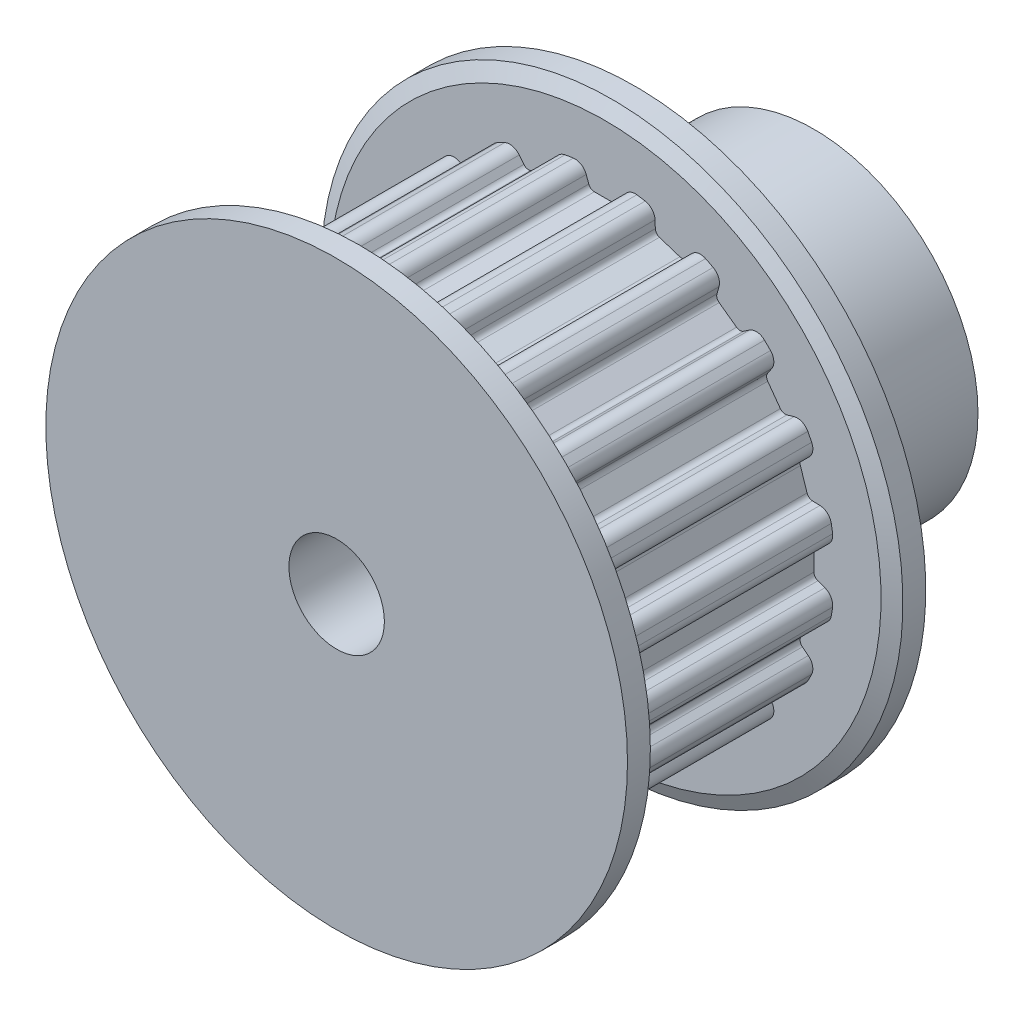
from build123d import *

# Parameters (mm, degrees)
SKETCH5_W           = 10
SKETCH5_H           = 7.7
SKETCH16_W          = 6
SKETCH16_H          = 5.5
SKETCH17_W          = 16
SKETCH17_H          = 2
CUT_TOOTH_REACH     = 21.354
PATTERN_TOOTH_COUNT = 20
SKETCH_2_R          = 2.9
CUT_EXTRUDE_1_DEPTH = 10
SKETCH_3_R          = 2.876983992
SKETCH_3_R_2        = 1.6
EXTRUDE_1_DEPTH     = 7


with BuildPart() as part:
    # Sketch5 → body (revolve)
    with BuildSketch(Plane(origin=(0, 0, 0), x_dir=(0, 0, -1), z_dir=(1, 0, 0))):
        with Locations((5, 3.85)):
            Rectangle(SKETCH5_W, SKETCH5_H)
    revolve(axis=Axis((0, 0, 0), (0, 0, -1)))

    # Sketch16 → body-hub (revolve)
    with BuildSketch(Plane(origin=(0, 0, 0), x_dir=(0, 0, -1), z_dir=(1, 0, 0))):
        with Locations((13, 2.75)):
            Rectangle(SKETCH16_W, SKETCH16_H)
    revolve(axis=Axis((0, 0, -16), (0, 0, 1)))

    # Sketch17 → body-bore (revolve, cut)
    with BuildSketch(Plane(origin=(0, 0, 0), x_dir=(0, 0, -1), z_dir=(1, 0, 0))):
        with Locations((8, 1)):
            Rectangle(SKETCH17_W, SKETCH17_H)
    revolve(axis=Axis((0, 0, -16), (0, 0, 1)), mode=Mode.SUBTRACT)

    # Sketch23 → cut-tooth (cut, up to next)
    with BuildSketch(Plane.XY, mode=Mode.PRIVATE) as cut_tooth_sk1:
        with BuildLine():
            Line((0.547897017, 7.131595971), (0.633465137, 7.366692451))
            ThreePointArc((0.633465137, 7.366692451), (0.803169961, 7.572656933), (1.064648607, 7.626042443))
            Line((1.064648607, 7.626042443), (1.064648607, 8.252084886))
            Line((1.064648607, 8.252084886), (-1.064648607, 8.252084886))
            Line((-1.064648607, 8.252084886), (-1.064648607, 7.626042443))
            ThreePointArc((-1.064648607, 7.626042443), (-0.803169961, 7.572656933), (-0.633465137, 7.366692451))
            Line((-0.633465137, 7.366692451), (-0.547897017, 7.131595971))
            ThreePointArc((-0.547897017, 7.131595971), (-0.47467378, 7.036169591), (-0.359958492, 7))
            Line((-0.359958492, 7), (0.359958492, 7))
            ThreePointArc((0.359958492, 7), (0.47467378, 7.036169591), (0.547897017, 7.131595971))
        make_face()
    cut_tooth_tool1 = extrude(cut_tooth_sk1.sketch, amount=-CUT_TOOTH_REACH, mode=Mode.PRIVATE) & part.part
    cut_tooth = cut_tooth_tool1.solids().sort_by_distance((0, 7.717665, 0))[0]
    add(cut_tooth, mode=Mode.SUBTRACT)

    # pattern-tooth: cut-tooth ×20 about axis
    pattern_tooth_axis = Axis((0, 0, -10), (0, 0, 1))
    for i in range(1, PATTERN_TOOTH_COUNT):
        add(cut_tooth.rotate(pattern_tooth_axis, i * 360 / PATTERN_TOOTH_COUNT), mode=Mode.SUBTRACT)

    # Sketch25 → body-flange-front (revolve)
    with BuildSketch(Plane(origin=(0, 0, 0), x_dir=(0, 0, -1), z_dir=(1, 0, 0))):
        Polygon((1, 4.85), (0, 4.85), (0, 8.116666667), (0, 9.75), (1, 9.75), (1, 8.116666667), align=None)
    revolve(axis=Axis((0, 0, 0), (0, 0, -1)))

    # Sketch26 → body-flange-back (revolve)
    with BuildSketch(Plane(origin=(0, 0, 0), x_dir=(0, 0, -1), z_dir=(1, 0, 0))):
        Polygon((9, 4.85), (10, 4.85), (10, 8.116666667), (10, 9.75), (9, 9.75), (9, 8.116666667), align=None)
    revolve(axis=Axis((0, 0, -10), (0, 0, 1)))

    # Sketch28 → body-flange-profile-front (revolve, cut)
    with BuildSketch(Plane(origin=(0, 0, 0), x_dir=(0, 0, -1), z_dir=(1, 0, 0))):
        Polygon((1, 9.75), (1, 9.25), (0.766846171, 9.75), align=None)
    revolve(axis=Axis((0, 0, -10), (0, 0, 1)), mode=Mode.SUBTRACT)

    # Sketch29 → body-flange-profile-back (revolve, cut)
    with BuildSketch(Plane(origin=(0, 0, 0), x_dir=(0, 0, -1), z_dir=(1, 0, 0))):
        Polygon((9, 9.75), (9, 9.25), (9.233153829, 9.75), align=None)
    revolve(axis=Axis((0, 0, -10), (0, 0, 1)), mode=Mode.SUBTRACT)

    # 草图2 → 切除-拉伸1 (cut)
    with BuildSketch(Plane(origin=(0, 0, -16), x_dir=(-1, 0, 0), z_dir=(0, 0, -1))):
        Circle(SKETCH_2_R)
    extrude(amount=-CUT_EXTRUDE_1_DEPTH, mode=Mode.SUBTRACT)

    # 草图3 → 凸台-拉伸1 (add)
    with BuildSketch(Plane.XY):
        Circle(SKETCH_3_R)
        Circle(SKETCH_3_R_2, mode=Mode.SUBTRACT)
    extrude(amount=-EXTRUDE_1_DEPTH)


solid = part.part
